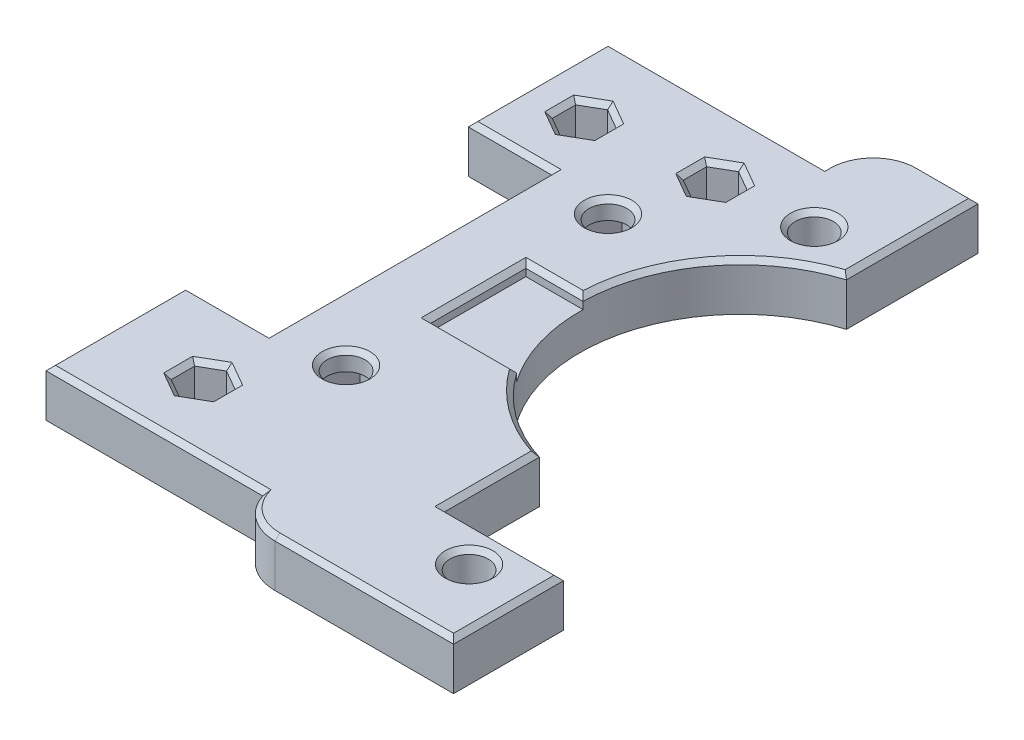
from build123d import *

# Parameters (mm, degrees)
SKETCH_1_W           = 20
SKETCH_1_H           = 35.74
EXTRUDE_1_DEPTH      = 4
SKETCH_2_W           = 8.8
SKETCH_2_H           = 8.5
SKETCH_2_H_2         = 9.8
EXTRUDE_2_DEPTH      = 4
SKETCH_3_R           = 13.5
CUT_EXTRUDE_1_DEPTH  = 10
SKETCH_4_W           = 9
SKETCH_4_H           = 5
CUT_EXTRUDE_2_DEPTH  = 1
SKETCH_5_W           = 9.228972975
SKETCH_5_H           = 4
EXTRUDE_3_DEPTH      = 10
SKETCH_6_R           = 1.6
CUT_EXTRUDE_3_DEPTH  = 10
SKETCH_7_R           = 1.6
CUT_EXTRUDE_4_DEPTH  = 55.679901244
SKETCH_8_W           = 11.2
SKETCH_8_H           = 4
EXTRUDE_4_DEPTH      = 4
SKETCH_9_R           = 1.65
CUT_EXTRUDE_5_DEPTH  = 55.679901244
SKETCH_10_W          = 10
SKETCH_10_H          = 4
EXTRUDE_5_DEPTH      = 7
SKETCH_11_R          = 1.65
CUT_EXTRUDE_6_DEPTH  = 8
SKETCH_12_W          = 6.6
SKETCH_12_H          = 5
CUT_EXTRUDE_7_DEPTH  = 1
SKETCH_13_R          = 1.55
CUT_EXTRUDE_8_DEPTH  = 5
SKETCH_14_W          = 18.2
SKETCH_14_H          = 1.73
EXTRUDE_6_DEPTH      = 4
SKETCH_16_W          = 10
SKETCH_16_H          = 8
CUT_EXTRUDE_9_DEPTH  = 1
CUT_EXTRUDE_10_DEPTH = 2.4
FILLET_1_R           = 4
CUT_EXTRUDE_11_DEPTH = 55.679901244
CHAMFER_1_SIZE       = 0.4


with BuildPart() as part:
    # 草图1 → 凸台-拉伸1 (new body)
    with BuildSketch(Plane(origin=(0, 0, 0), x_dir=(1, 0, 0), z_dir=(0, 1, 0))):
        with Locations((10, 17.87)):
            Rectangle(SKETCH_1_W, SKETCH_1_H)
    extrude(amount=EXTRUDE_1_DEPTH)

    # 草图2 → 凸台-拉伸2 (add)
    with BuildSketch(Plane.XZ):
        with Locations((15.6, 4.25)):
            Rectangle(SKETCH_2_W, SKETCH_2_H)
        with Locations((15.6, -40.64)):
            Rectangle(SKETCH_2_W, SKETCH_2_H_2)
    extrude(amount=-EXTRUDE_2_DEPTH)

    # 草图3 → 切除-拉伸1 (cut)
    with BuildSketch(Plane(origin=(0, 0, 0), x_dir=(-1, 0, 0), z_dir=(0, -1, 0))):
        with Locations((-24, 21.6)):
            Circle(SKETCH_3_R)
    extrude(amount=-CUT_EXTRUDE_1_DEPTH, mode=Mode.SUBTRACT)

    # 草图4 → 切除-拉伸2 (cut)
    with BuildSketch(Plane(origin=(0, 0, 0), x_dir=(-1, 0, 0), z_dir=(0, -1, 0))):
        with Locations((-13.5, -0.75)):
            Rectangle(SKETCH_4_W, SKETCH_4_H)
    extrude(amount=-CUT_EXTRUDE_2_DEPTH, mode=Mode.SUBTRACT)

    # 草图5 → 凸台-拉伸3 (add)
    with BuildSketch(Plane(origin=(20, 0, 0), x_dir=(0, 0, -1), z_dir=(1, 0, 0))):
        with Locations((-3.885513513, 2)):
            Rectangle(SKETCH_5_W, SKETCH_5_H)
    extrude(amount=EXTRUDE_3_DEPTH)

    # 草图6 → 切除-拉伸3 (cut)
    with BuildSketch(Plane(origin=(0, 0, 0), x_dir=(-1, 0, 0), z_dir=(0, -1, 0))):
        with Locations(Location((-15.2, 36.59, 0), (0, 0, 90))):
            Circle(SKETCH_6_R)
        with Locations(Location((-25.25, -2.45, 0), (0, 0, 90))):
            Circle(SKETCH_6_R)
    extrude(amount=-CUT_EXTRUDE_3_DEPTH, mode=Mode.SUBTRACT)

    # 草图7 → 切除-拉伸4 (cut, through all)
    with BuildSketch(Plane(origin=(0, 0, 0), x_dir=(-1, 0, 0), z_dir=(0, -1, 0))):
        with Locations(Location((-5.6, 28.87, 0), (0, 0, 90))):
            Circle(SKETCH_7_R)
        with Locations(Location((-5.6, 6.87, 0), (0, 0, 90))):
            Circle(SKETCH_7_R)
    extrude(amount=-CUT_EXTRUDE_4_DEPTH, mode=Mode.SUBTRACT)

    # 草图8 → 凸台-拉伸4 (add)
    with BuildSketch(Plane.XZ):
        with Locations((5.6, -37.74)):
            Rectangle(SKETCH_8_W, SKETCH_8_H)
        with Locations((5.6, 2)):
            Rectangle(SKETCH_8_W, SKETCH_8_H)
    extrude(amount=-EXTRUDE_4_DEPTH)

    # 草图9 → 切除-拉伸5 (cut, through all)
    with BuildSketch(Plane(origin=(0, 0, 0), x_dir=(-1, 0, 0), z_dir=(0, -1, 0))):
        with Locations(Location((-7.6, 35.87, 0), (0, 0, 90))):
            Circle(SKETCH_9_R)
        with Locations((-0.6, -0.13)):
            Circle(SKETCH_9_R)
    extrude(amount=-CUT_EXTRUDE_5_DEPTH, mode=Mode.SUBTRACT)

    # 草图10 → 凸台-拉伸5 (add)
    with BuildSketch(Plane.ZY):
        with Locations((-34.74, 2)):
            Rectangle(SKETCH_10_W, SKETCH_10_H)
        with Locations((-1, 2)):
            Rectangle(SKETCH_10_W, SKETCH_10_H)
    extrude(amount=EXTRUDE_5_DEPTH)

    # 草图11 → 切除-拉伸6 (cut)
    with BuildSketch(Plane(origin=(0, 0, 0), x_dir=(-1, 0, 0), z_dir=(0, -1, 0))):
        with Locations(Location((2.4, 34.87, 0), (0, 0, 90))):
            Circle(SKETCH_11_R)
    extrude(amount=-CUT_EXTRUDE_6_DEPTH, mode=Mode.SUBTRACT)

    # 草图12 → 切除-拉伸7 (cut)
    with BuildSketch(Plane(origin=(0, 0, 0), x_dir=(-1, 0, 0), z_dir=(0, -1, 0))):
        with Locations((-7.9, -0.75)):
            Rectangle(SKETCH_12_W, SKETCH_12_H)
    extrude(amount=-CUT_EXTRUDE_7_DEPTH, mode=Mode.SUBTRACT)

    # 草图13 → 切除-拉伸8 (cut)
    with BuildSketch(Plane(origin=(0, 0, 0), x_dir=(-1, 0, 0), z_dir=(0, -1, 0))):
        with Locations((-0.6, -0.13)):
            Circle(SKETCH_13_R)
    extrude(amount=-CUT_EXTRUDE_8_DEPTH, mode=Mode.SUBTRACT)

    # 草图14 → 凸台-拉伸6 (add)
    with BuildSketch(Plane(origin=(0, 0, 0), x_dir=(-1, 0, 0), z_dir=(0, -1, 0))):
        with Locations((-2.1, -4.865)):
            Rectangle(SKETCH_14_W, SKETCH_14_H)
        with Locations((-2.1, 40.605)):
            Rectangle(SKETCH_14_W, SKETCH_14_H)
    extrude(amount=-EXTRUDE_6_DEPTH)

    # 草图16 → 切除-拉伸9 (cut)
    with BuildSketch(Plane(origin=(0, 4, 0), x_dir=(1, 0, 0), z_dir=(0, 1, 0))):
        with Locations((10.7, 17.87)):
            Rectangle(SKETCH_16_W, SKETCH_16_H)
    extrude(amount=-CUT_EXTRUDE_9_DEPTH, mode=Mode.SUBTRACT)

    # 草图17 → 切除-拉伸10 (cut)
    with BuildSketch(Plane(origin=(0, 0, 0), x_dir=(-1, 0, 0), z_dir=(0, -1, 0))):
        Polygon((-8.833161507, 28.87), (-7.216580754, 26.07), (-3.983419246, 26.07), (-2.366838493, 28.87), (-3.983419246, 31.67), (-7.216580754, 31.67), align=None)
        Polygon((-8.833161507, 6.87), (-7.216580754, 4.07), (-3.983419246, 4.07), (-2.366838493, 6.87), (-3.983419246, 9.67), (-7.216580754, 9.67), align=None)
    extrude(amount=-CUT_EXTRUDE_10_DEPTH, mode=Mode.SUBTRACT)

    # 圆角1
    # the kernel refuses this fillet: 4 mm, written as the material it takes off along each edge
    with BuildSketch(Plane(origin=(11.2, -9.515480808, 8.5), x_dir=(1, 0, 0), z_dir=(0, 1, 0))) as fillet_1_piece_1:
        with BuildLine():
            CenterArc((3.806192323, 4), FILLET_1_R, 197.908633295, 72.091366705)
            Line((0, 2.77), (-0.076123846, 2.7454))
            ThreePointArc((-0.076123846, 2.7454), (-0.08, 1.385), (-0.08, 0))
            Line((-0.08, 0), (0, -0.08))
            Line((0, -0.08), (3.806192323, -0.08))
            Line((3.806192323, -0.08), (3.806192323, 0))
        make_face()
    extrude(amount=23.030961615, mode=Mode.SUBTRACT)
    with BuildSketch(Plane(origin=(11.2, -10, -45.54), x_dir=(0, 0, 1), z_dir=(0, 1, 0))) as fillet_1_piece_2:
        with BuildLine():
            CenterArc((FILLET_1_R, FILLET_1_R), FILLET_1_R, 180, 90)
            Line((0, FILLET_1_R), (-FILLET_1_R * 0.02, FILLET_1_R))
            Line((-FILLET_1_R * 0.02, FILLET_1_R), (-FILLET_1_R * 0.02, -FILLET_1_R * 0.02))
            Line((-FILLET_1_R * 0.02, -FILLET_1_R * 0.02), (FILLET_1_R, -FILLET_1_R * 0.02))
            Line((FILLET_1_R, -FILLET_1_R * 0.02), (FILLET_1_R, 0))
        make_face()
    extrude(amount=24, mode=Mode.SUBTRACT)

    # 草图19 → 切除-拉伸11 (cut, through all)
    with BuildSketch(Plane(origin=(0, 4, 0), x_dir=(1, 0, 0), z_dir=(0, 1, 0))):
        Polygon((0.6, -2.092990915), (2.3, -1.111495458), (2.3, 0.851495458), (0.6, 1.832990915), (-1.1, 0.851495458), (-1.1, -1.111495458), align=None)
        Polygon((-2.4, 32.907009085), (-0.7, 33.888504542), (-0.7, 35.851495458), (-2.4, 36.832990915), (-4.1, 35.851495458), (-4.1, 33.888504542), align=None)
        Polygon((7.6, 33.907009085), (9.3, 34.888504542), (9.3, 36.851495458), (7.6, 37.832990915), (5.9, 36.851495458), (5.9, 34.888504542), align=None)
    extrude(amount=-CUT_EXTRUDE_11_DEPTH, mode=Mode.SUBTRACT)

    # 倒角1
    chamfer_1_edges = [part.edges().sort_by_distance(p)[0] for p in [
        (5.6, 4, -5.27),
        (0, 4, -17.87),
        (-3.5, 4, -29.74),
        (-7, 4, -35.605),
        (22.503096162, 4, 8.5),
        (-3.5, 4, -6),
        (-7, 4, -0.135),
        (2.1, 4, 5.73),
        (11.2, 4, -41.505),
        (2.1, 4, -41.47),
        (13.212093026, 4, -29.716099009),
        (8.101350135, 4, -21.87),
        (5.7, 4, -17.87),
        (9.316079599, 4, -13.87),
        (17.6, 4, -45.54),
        (12.371572875, 4, -44.368427125),
        (12.652471864, 4, 7.734192326),
        (-0.25, 4, 1.602243186),
        (1.45, 4, 1.602243186),
        (2.3, 4, 0.13),
        (1.45, 4, -1.342243186),
        (-0.25, 4, -1.342243186),
        (-1.1, 4, 0.13),
        (-3.25, 4, -33.397756814),
        (-1.55, 4, -33.397756814),
        (-0.7, 4, -34.87),
        (-1.55, 4, -36.342243186),
        (-3.25, 4, -36.342243186),
        (-4.1, 4, -34.87),
        (6.75, 4, -34.397756814),
        (8.45, 4, -34.397756814),
        (9.3, 4, -35.87),
        (8.45, 4, -37.342243186),
        (6.75, 4, -37.342243186),
        (5.9, 4, -35.87),
        (20, 4, -40.016898479),
        (16.035945985, 4, -10.699364989),
        (20, 4, -4.717588008),
        (25, 4, -0.728972975),
        (30, 4, 3.885513513),
        (15.2, 4, -34.99),
        (25.25, 4, 4.05),
        (5.6, 4, -27.27),
    ]]
    chamfer(chamfer_1_edges, length=CHAMFER_1_SIZE)


solid = part.part
